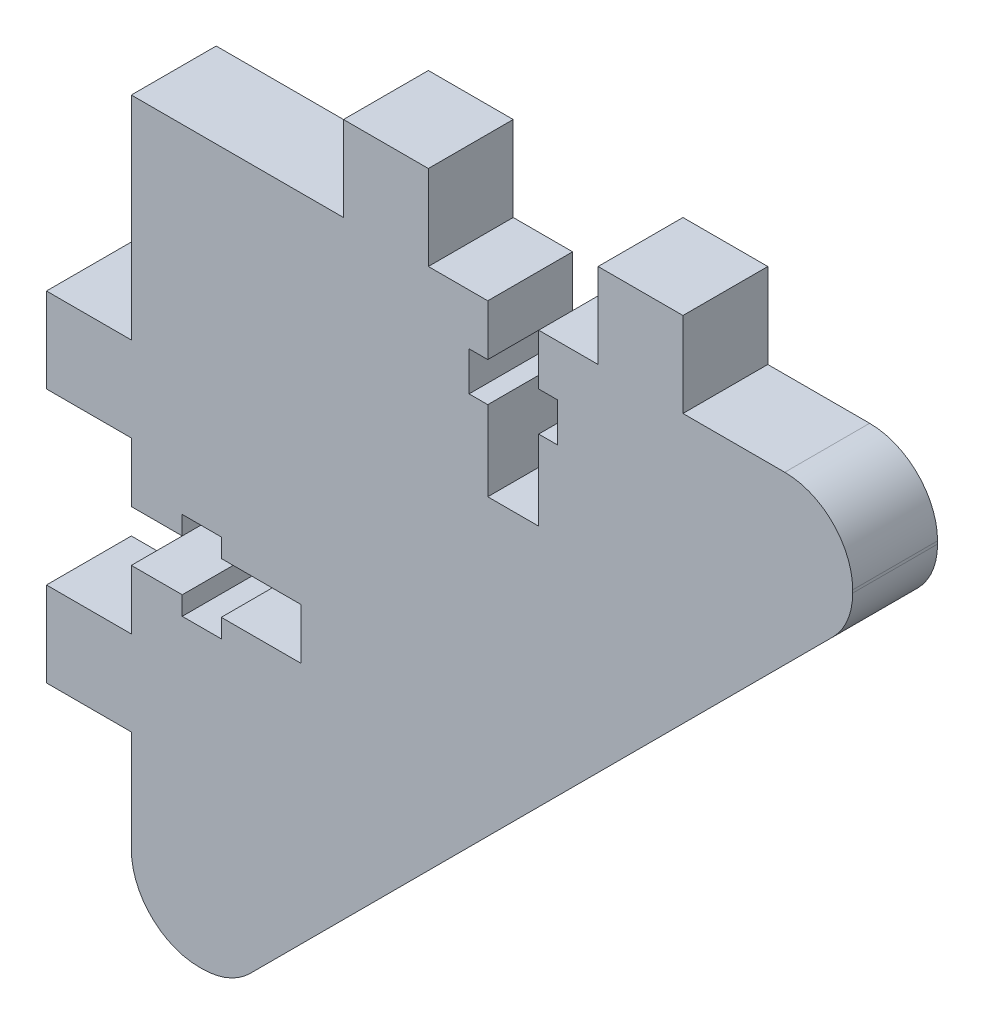
from build123d import *

# Parameters (mm, degrees)
BOSS_EXTRUDE1_DEPTH = 5


with BuildPart() as part:
    # Sketch1 → Boss-Extrude1 (new body)
    with BuildSketch(Plane.XY):
        with BuildLine():
            Line((17.5, -5), (5, -5))
            Line((5, -5), (5, -17.5))
            Line((5, -17.5), (0, -17.5))
            Line((0, -17.5), (0, -22.5))
            Line((0, -22.5), (5, -22.5))
            Line((5, -22.5), (5, -26))
            Line((5, -26), (8, -26))
            Line((8, -26), (8, -24.9))
            Line((8, -24.9), (10.3, -24.9))
            Line((10.3, -24.9), (10.3, -26))
            Line((10.3, -26), (15, -26))
            Line((15, -26), (15, -29))
            Line((15, -29), (10.3, -29))
            Line((10.3, -29), (10.3, -30.1))
            Line((10.3, -30.1), (8, -30.1))
            Line((8, -30.1), (8, -29))
            Line((8, -29), (5, -29))
            Line((5, -29), (5, -32.5))
            Line((5, -32.5), (0, -32.5))
            Line((0, -32.5), (0, -37.5))
            Line((0, -37.5), (5, -37.5))
            Line((5, -37.5), (5, -43.5))
            ThreePointArc((5, -43.5), (6.171572875, -46.328427125), (9, -47.5))
            Line((9, -47.5), (9.165507919, -47.5))
            ThreePointArc((9.165507919, -47.5), (10.696241649, -47.19551813), (11.993935044, -46.328427125))
            Line((11.993935044, -46.328427125), (46.328427125, -11.993935044))
            ThreePointArc((46.328427125, -11.993935044), (47.19551813, -10.696241649), (47.5, -9.165507919))
            Line((47.5, -9.165507919), (47.5, -9))
            ThreePointArc((47.5, -9), (46.328427125, -6.171572875), (43.5, -5))
            Line((43.5, -5), (37.5, -5))
            Line((37.5, -5), (37.5, 0))
            Line((37.5, 0), (32.5, 0))
            Line((32.5, 0), (32.5, -5))
            Line((32.5, -5), (29, -5))
            Line((29, -5), (29, -8))
            Line((29, -8), (30.1, -8))
            Line((30.1, -8), (30.1, -10.3))
            Line((30.1, -10.3), (29, -10.3))
            Line((29, -10.3), (29, -15))
            Line((29, -15), (26, -15))
            Line((26, -15), (26, -10.3))
            Line((26, -10.3), (24.9, -10.3))
            Line((24.9, -10.3), (24.9, -8))
            Line((24.9, -8), (26, -8))
            Line((26, -8), (26, -5))
            Line((26, -5), (22.5, -5))
            Line((22.5, -5), (22.5, 0))
            Line((22.5, 0), (17.5, 0))
            Line((17.5, 0), (17.5, -5))
        make_face()
    extrude(amount=BOSS_EXTRUDE1_DEPTH)


solid = part.part
